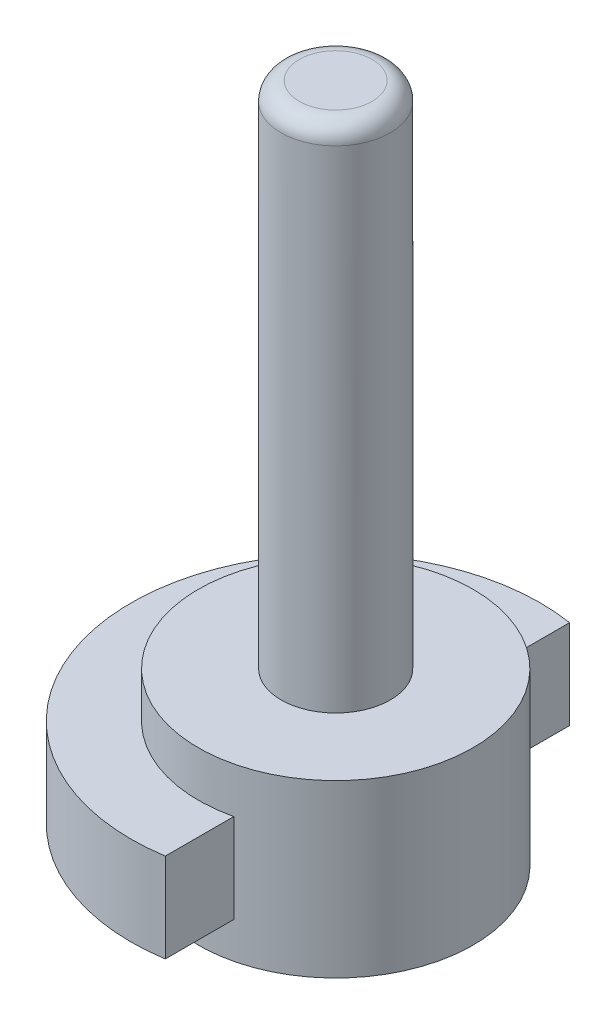
from build123d import *

# Parameters (mm, degrees)
SKETCH1_R           = 3
BOSS_EXTRUDE1_DEPTH = 28
SKETCH2_R           = 7.55
BOSS_EXTRUDE2_DEPTH = 2.5
FILLET2_R           = 1
SKETCH3_R           = 11.25
BOSS_EXTRUDE3_DEPTH = 4.9
SKETCH5_R           = 7.55
BOSS_EXTRUDE5_DEPTH = 2
CUT_EXTRUDE1_DEPTH  = 10
CUT_EXTRUDE2_DEPTH  = 10


with BuildPart() as part:
    # Sketch1 → Boss-Extrude1 (new body)
    with BuildSketch(Plane(origin=(0, 0, 0), x_dir=(1, 0, 0), z_dir=(0, 1, 0))):
        Circle(SKETCH1_R)
    extrude(amount=BOSS_EXTRUDE1_DEPTH)

    # Sketch2 → Boss-Extrude2 (add)
    with BuildSketch(Plane(origin=(0, 0, 0), x_dir=(-1, 0, 0), z_dir=(0, -1, 0))):
        Circle(SKETCH2_R)
    extrude(amount=BOSS_EXTRUDE2_DEPTH)

    # Fillet2
    fillet2_edges = [part.edges().sort_by_distance(p)[0] for p in [
        (-3, 28, 0),
    ]]
    fillet(fillet2_edges, radius=FILLET2_R)

    # Sketch3 → Boss-Extrude3 (add)
    with BuildSketch(Plane(origin=(0, -2.5, 0), x_dir=(-1, 0, 0), z_dir=(0, -1, 0))):
        Circle(SKETCH3_R)
    extrude(amount=BOSS_EXTRUDE3_DEPTH)

    # Sketch5 → Boss-Extrude5 (add)
    with BuildSketch(Plane.XZ.offset(7.4)):
        Circle(SKETCH5_R)
    extrude(amount=BOSS_EXTRUDE5_DEPTH)

    # Sketch6 → Cut-Extrude1 (cut)
    with BuildSketch(Plane(origin=(0, -2.5, 0), x_dir=(1, 0, 0), z_dir=(0, 1, 0))):
        with BuildLine():
            Line((1.746254966, -7.345276958), (17.270816003, -7.345276958))
            Line((17.270816003, -7.345276958), (17.270816003, 7.345276958))
            Line((17.270816003, 7.345276958), (1.746254966, 7.345276958))
            ThreePointArc((1.746254966, 7.345276958), (7.55, 0), (1.746254966, -7.345276958))
        make_face()
    extrude(amount=-CUT_EXTRUDE1_DEPTH, mode=Mode.SUBTRACT)

    # Sketch8 → Cut-Extrude2 (cut)
    with BuildSketch(Plane(origin=(0, -2.5, 0), x_dir=(1, 0, 0), z_dir=(0, 1, 0))):
        with BuildLine():
            Line((8.521115326, 7.345276958), (1.746254966, 7.345276958))
            Line((1.746254966, 7.345276958), (1.746254966, 11.113644479))
            ThreePointArc((1.746254966, 11.113644479), (5.468534687, 9.831461152), (8.521115326, 7.345276958))
        make_face()
        with BuildLine():
            Line((1.746254966, -7.345276958), (8.521115326, -7.345276958))
            ThreePointArc((8.521115326, -7.345276958), (5.468534687, -9.831461152), (1.746254966, -11.113644479))
            Line((1.746254966, -11.113644479), (1.746254966, -7.345276958))
        make_face()
    extrude(amount=-CUT_EXTRUDE2_DEPTH, mode=Mode.SUBTRACT)


solid = part.part
